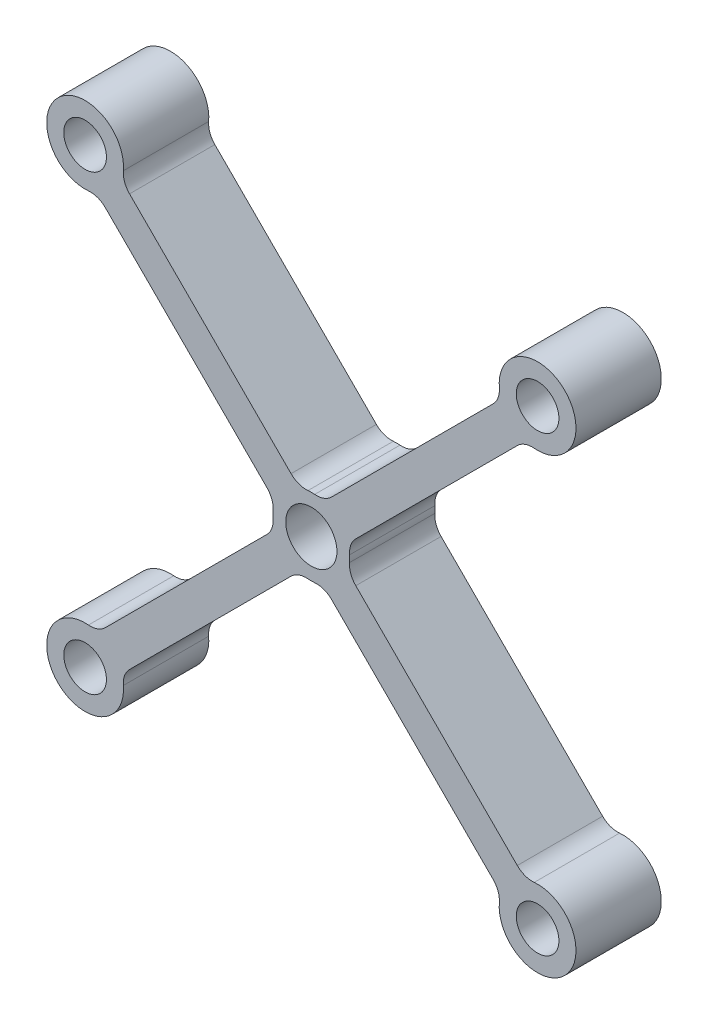
from build123d import *

# Parameters (mm, degrees)
BOSS_EXTRUDE1_DEPTH = 10
CIRPATTERN1_COUNT   = 4
FILLET1_R           = 2.5


with BuildPart() as part:
    # Sketch1 → Boss-Extrude1 (new body)
    with BuildSketch(Plane.XY):
        with BuildLine():
            ThreePointArc((-25.080279294, 22.251852169), (-23.334523779, 23.334523779), (-22.251852169, 25.080279294))
            Line((-22.251852169, 25.080279294), (-24.04163056, 26.870057685))
            ThreePointArc((-24.04163056, 26.870057685), (-24.022793772, 26.693726845), (-24.016504294, 26.516504294))
            ThreePointArc((-24.016504294, 26.516504294), (-24.878499941, 24.627869407), (-26.870057685, 24.04163056))
            Line((-26.870057685, 24.04163056), (-25.080279294, 22.251852169))
        make_face()
        with BuildLine():
            Line((-24.04163056, 26.870057685), (-22.251852169, 25.080279294))
            ThreePointArc((-22.251852169, 25.080279294), (-22.075731019, 25.788814307), (-22.016504294, 26.516504294))
            ThreePointArc((-22.016504294, 26.516504294), (-30.171159716, 29.142050666), (-25.080279294, 22.251852169))
            Line((-25.080279294, 22.251852169), (-26.870057685, 24.04163056))
            ThreePointArc((-26.870057685, 24.04163056), (-28.284271247, 28.284271247), (-24.04163056, 26.870057685))
        make_face()
        with BuildLine():
            ThreePointArc((-4.264652125, 1.436225), (-3.181980515, 3.181980515), (-1.436225, 4.264652125))
            Line((-1.436225, 4.264652125), (-22.251852169, 25.080279294))
            ThreePointArc((-22.251852169, 25.080279294), (-23.334523779, 23.334523779), (-25.080279294, 22.251852169))
            Line((-25.080279294, 22.251852169), (-4.264652125, 1.436225))
        make_face()
        with BuildLine():
            ThreePointArc((-2.995352392, 0.166925268), (-2.121320344, 2.121320344), (-0.166925268, 2.995352392))
            Line((-0.166925268, 2.995352392), (-1.436225, 4.264652125))
            ThreePointArc((-1.436225, 4.264652125), (-3.181980515, 3.181980515), (-4.264652125, 1.436225))
            Line((-4.264652125, 1.436225), (-2.995352392, 0.166925268))
        make_face()
        with BuildLine():
            Line((-1.436225, 4.264652125), (-0.166925268, 2.995352392))
            ThreePointArc((-0.166925268, 2.995352392), (2.061458731, 2.179538461), (3, 0))
            ThreePointArc((3, 0), (-0.083494978, -2.998837873), (-2.995352392, 0.166925268))
            Line((-2.995352392, 0.166925268), (-4.264652125, 1.436225))
            ThreePointArc((-4.264652125, 1.436225), (-0.727689988, -4.440773275), (4.5, 0))
            ThreePointArc((4.5, 0), (2.625546372, 3.654655422), (-1.436225, 4.264652125))
        make_face()
    extrude(amount=BOSS_EXTRUDE1_DEPTH)


with BuildPart() as cirpattern1_1:
    # CirPattern1: pattern copy
    add(part.part.rotate(Axis((0, 0, 0), (0, 0, 1)), 1 * 360 / CIRPATTERN1_COUNT))


with BuildPart() as cirpattern1_2:
    # CirPattern1: pattern copy
    add(part.part.rotate(Axis((0, 0, 0), (0, 0, 1)), 2 * 360 / CIRPATTERN1_COUNT))


with BuildPart() as cirpattern1_3:
    # CirPattern1: pattern copy
    add(part.part.rotate(Axis((0, 0, 0), (0, 0, 1)), 3 * 360 / CIRPATTERN1_COUNT))

    # Combine1: read off the stored shape, not the designer's step
    # Combine1: union CirPattern1_2, CirPattern1_1, part
    add(cirpattern1_2.part)
    add(cirpattern1_1.part)
    add(part.part)

    # Fillet1
    fillet1_edges = [cirpattern1_3.edges().sort_by_distance(p)[0] for p in [
        (-4.264652125, 1.436225, 5),
        (-25.080279294, 22.251852169, 5),
        (-22.251852169, 25.080279294, 5),
        (-1.436225, 4.264652125, 5),
        (-1.436225, -4.264652125, 5),
        (1.436225, 4.264652125, 5),
        (4.264652125, -1.436225, 5),
        (4.264652125, 1.436225, 5),
        (25.080279294, 22.251852169, 5),
        (22.251852169, 25.080279294, 5),
        (22.251852169, -25.080279294, 5),
        (25.080279294, -22.251852169, 5),
        (1.436225, -4.264652125, 5),
        (-4.264652125, -1.436225, 5),
        (-25.080279294, -22.251852169, 5),
        (-22.251852169, -25.080279294, 5),
    ]]
    fillet(fillet1_edges, radius=FILLET1_R)


solid = cirpattern1_3.part
